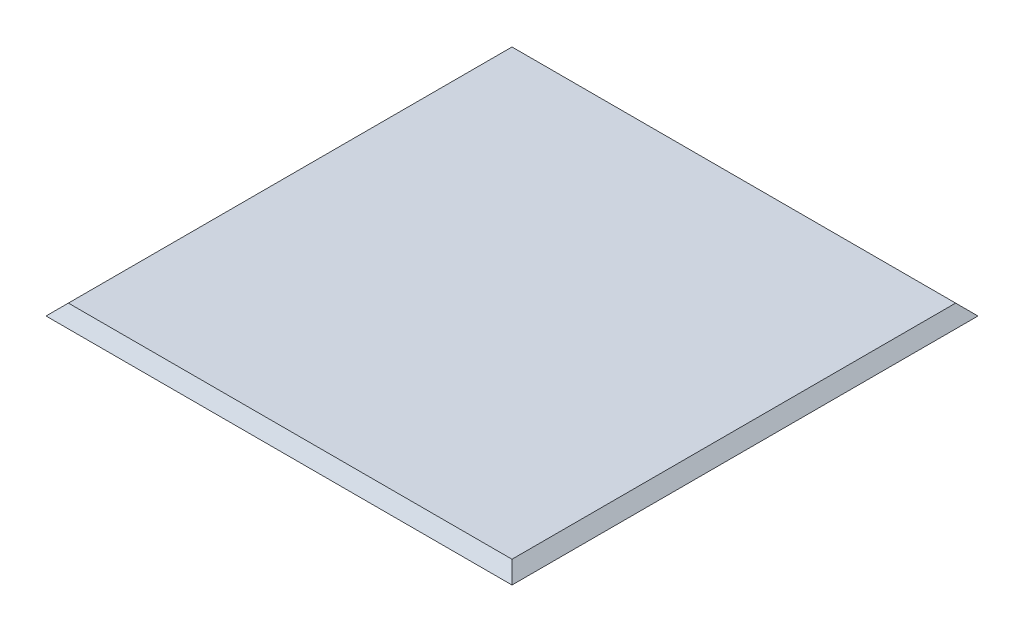
from build123d import *

# Parameters (mm, degrees)
SKETCH5_W           = 500
SKETCH5_H           = 500
BOSS_EXTRUDE1_DEPTH = 12
CHAMFER1_SIZE       = 12


with BuildPart() as part:
    # Sketch5 → Boss-Extrude1 (new body)
    with BuildSketch(Plane(origin=(0, 0, 0), x_dir=(1, 0, 0), z_dir=(0, 1, 0))):
        with Locations((250, 250)):
            Rectangle(SKETCH5_W, SKETCH5_H)
    extrude(amount=BOSS_EXTRUDE1_DEPTH)

    # Chamfer1
    chamfer1_edges = [part.edges().sort_by_distance(p)[0] for p in [
        (500, 12, -250),
        (250, 12, -500),
        (0, 12, -250),
        (250, 12, 0),
    ]]
    chamfer(chamfer1_edges, length=CHAMFER1_SIZE - 0.0001)  # a hair under: the kernel refuses the full size


solid = part.part
